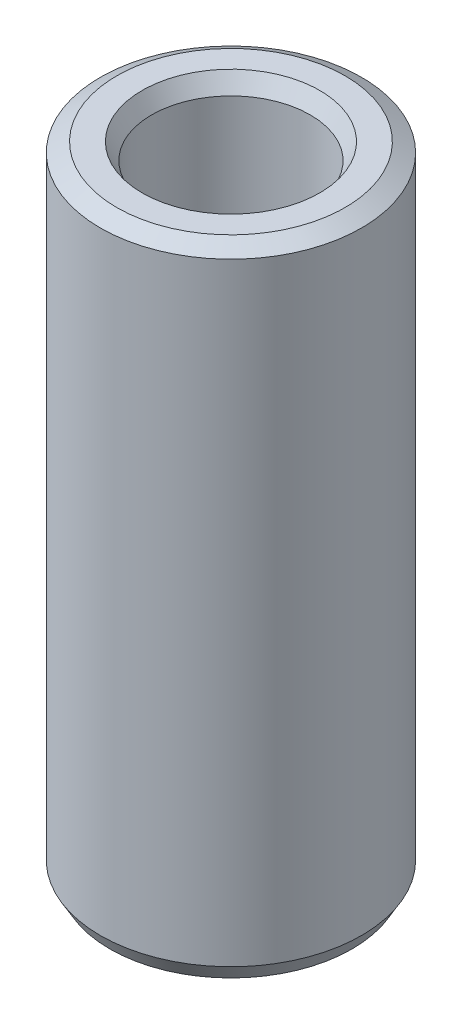
from build123d import *
from OCP.BRepFilletAPI import BRepFilletAPI_MakeChamfer

# Parameters (mm, degrees)
SKETCH1_R           = 35
BOSS_EXTRUDE1_DEPTH = 171.175300097
SKETCH2_R           = 21.259903326
CUT_EXTRUDE1_DEPTH  = 179.188056175
CHAMFER1_SIZE       = 2.541811948
CHAMFER1_SIZE2      = 4.402547438


with BuildPart() as part:
    # Sketch1 → Boss-Extrude1 (new body)
    with BuildSketch(Plane(origin=(0, 0, 0), x_dir=(1, 0, 0), z_dir=(0, 1, 0))):
        Circle(SKETCH1_R)
    extrude(amount=BOSS_EXTRUDE1_DEPTH)

    # Sketch2 → Cut-Extrude1 (cut, through all)
    with BuildSketch(Plane(origin=(0, 0, 0), x_dir=(1, 0, 0), z_dir=(0, 1, 0))):
        Circle(SKETCH2_R)
    extrude(amount=CUT_EXTRUDE1_DEPTH, mode=Mode.SUBTRACT)

    # Chamfer1: one chamfer whose edges measure the first distance from different faces: ONE call of the kernel's chamfer builder (chamfer() names one face for all edges)
    chamfer1_edges_1 = [part.edges().sort_by_distance(p)[0] for p in [
        (-21.259903326, 171.175300097, 0),
    ]]
    chamfer1_side_1 = [part.faces().sort_by_distance(p)[0] for p in [
        (-34.010050506, 171.175300097, 0),
    ]]
    chamfer1_edges_2 = [part.edges().sort_by_distance(p)[0] for p in [
        (-21.259903326, 0, 0),
    ]]
    chamfer1_side_2 = [part.faces().sort_by_distance(p)[0] for p in [
        (-21.259903326, 85.587650048, 0),
    ]]
    chamfer1_edges_3 = [part.edges().sort_by_distance(p)[0] for p in [
        (-35, 0, 0),
    ]]
    chamfer1_side_3 = [part.faces().sort_by_distance(p)[0] for p in [
        (-34.010050506, 0, 0),
    ]]
    chamfer1_edges_4 = [part.edges().sort_by_distance(p)[0] for p in [
        (-35, 171.175300097, 0),
    ]]
    chamfer1_side_4 = [part.faces().sort_by_distance(p)[0] for p in [
        (-35, 85.587650048, 0),
    ]]
    chamfer1 = BRepFilletAPI_MakeChamfer(part.part.solid().wrapped)
    for e in chamfer1_edges_1:
        chamfer1.Add(CHAMFER1_SIZE, CHAMFER1_SIZE2, e.wrapped, chamfer1_side_1[0].wrapped)  # the first distance lies on this face
    for e in chamfer1_edges_2:
        chamfer1.Add(CHAMFER1_SIZE, CHAMFER1_SIZE2, e.wrapped, chamfer1_side_2[0].wrapped)  # the first distance lies on this face
    for e in chamfer1_edges_3:
        chamfer1.Add(CHAMFER1_SIZE, CHAMFER1_SIZE2, e.wrapped, chamfer1_side_3[0].wrapped)  # the first distance lies on this face
    for e in chamfer1_edges_4:
        chamfer1.Add(CHAMFER1_SIZE, CHAMFER1_SIZE2, e.wrapped, chamfer1_side_4[0].wrapped)  # the first distance lies on this face
    add(Compound.cast(chamfer1.Shape()), mode=Mode.REPLACE)


solid = part.part
